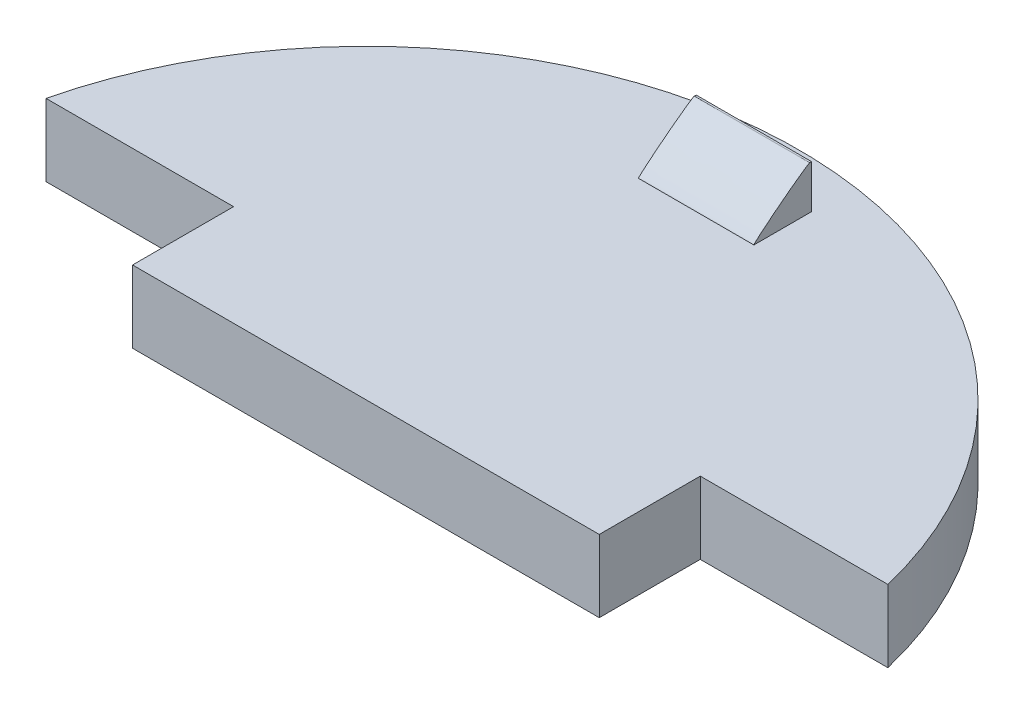
from build123d import *

# Parameters (mm, degrees)
BOSS_EXTRUDE1_DEPTH = 5
SKETCH3_W           = 8
SKETCH3_H           = 4
BOSS_EXTRUDE2_DEPTH = 3
FILLET1_START       = -3.841593316
FILLET1_DEPTH       = 8
CUT_EXTRUDE1_START  = -10
CUT_EXTRUDE1_DEPTH  = 10


with BuildPart() as part:
    # Sketch1 → Boss-Extrude1 (new body)
    with BuildSketch(Plane(origin=(0, 0, 0), x_dir=(1, 0, 0), z_dir=(0, 1, 0))):
        with BuildLine():
            Line((-30, 0), (30, 0))
            ThreePointArc((30, 0), (0, 30), (-30, 0))
        make_face()
    extrude(amount=BOSS_EXTRUDE1_DEPTH)

    # Sketch3 → Boss-Extrude2 (add)
    with BuildSketch(Plane(origin=(0, 5, 0), x_dir=(1, 0, 0), z_dir=(0, 1, 0))):
        with Locations((0.158406684, 24.731666579)):
            Rectangle(SKETCH3_W, SKETCH3_H)
    extrude(amount=BOSS_EXTRUDE2_DEPTH)

    # Fillet1: read off the stored shape, not the designer's step
    # Fillet1 outline → Fillet1 (cut)
    with BuildSketch(Plane.YZ.offset(FILLET1_START)):
        with BuildLine():
            Line((8, -22.731666579), (5, -22.731666579))
            add(Edge.make_bspline(
                [(5, -22.731666579), (8, -23.506263249), (8, -26.604649926)],
                knots=[0, 0, 0, 1, 1, 1], degree=2, weights=[1, 0.057495957, 1]))
            Line((8, -26.604649926), (8, -22.731666579))
        make_face()
    extrude(amount=FILLET1_DEPTH, mode=Mode.SUBTRACT)

    # Sketch5 → Cut-Extrude1 (cut)
    with BuildSketch(Plane(origin=(0, 5, 0), x_dir=(1, 0, 0), z_dir=(0, 1, 0)).offset(CUT_EXTRUDE1_START)):
        with BuildLine():
            Line((-16.171904292, 0), (-16.171904292, 7))
            Line((-16.171904292, 7), (-29.171904292, 7))
            ThreePointArc((-29.171904292, 7), (-29.792256786, 3.524405712), (-30, 0))
            Line((-30, 0), (-16.171904292, 0))
        make_face()
        with BuildLine():
            Line((16.171904292, 7), (29.171904292, 7))
            ThreePointArc((29.171904292, 7), (29.792256786, 3.524405712), (30, 0))
            Line((30, 0), (16.171904292, 0))
            Line((16.171904292, 0), (16.171904292, 7))
        make_face()
    extrude(amount=CUT_EXTRUDE1_DEPTH, mode=Mode.SUBTRACT)


solid = part.part
